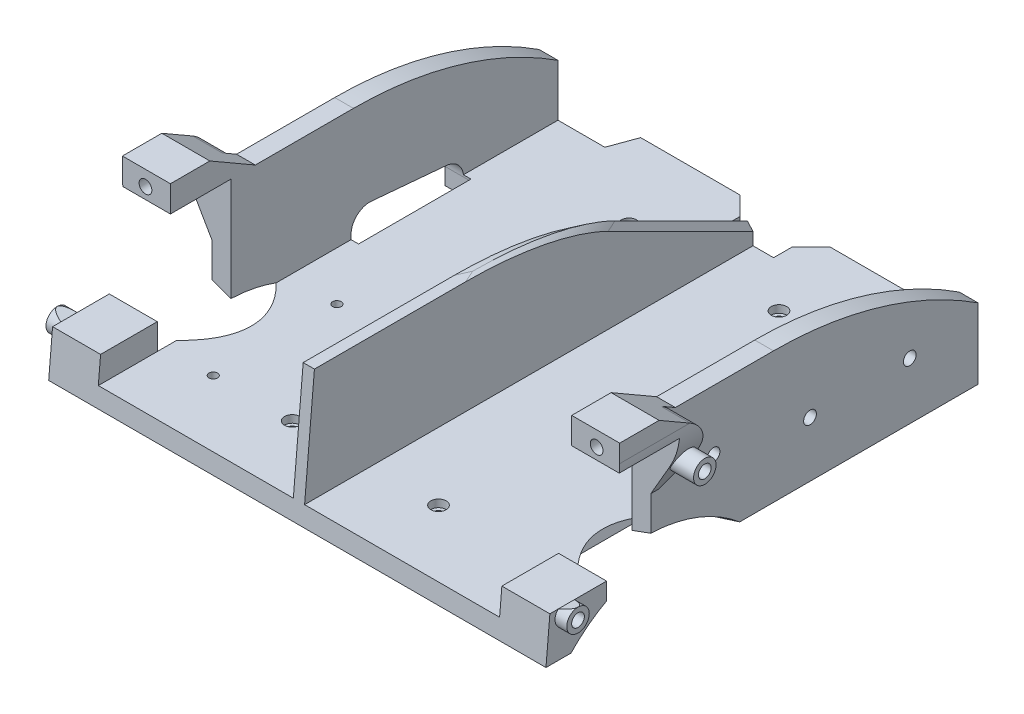
from build123d import *
from OCP.BRepFilletAPI import BRepFilletAPI_MakeChamfer

# Parameters (mm, degrees)
SKIZZE1_W                             = 113
SKIZZE1_H                             = 130
AUFSATZ_LINEAR_AUSTRAGEN1_DEPTH       = 5
SKIZZE2_W                             = 3
SKIZZE2_H                             = 130
AUFSATZ_LINEAR_AUSTRAGEN2_DEPTH       = 30
SKIZZE6_W                             = 113
SKIZZE6_H                             = 3.050450996
SCHNITT_LINEAR_AUSTRAGEN4_DEPTH       = 118.72988197
SCHNITT_LINEAR_AUSTRAGEN6_DEPTH       = 10
AUFSATZ_LINEAR_AUSTRAGEN3_REACH       = 133.888
AUFSATZ_LINEAR_START                  = 0.5
SKIZZE10_W                            = 12.8
SKIZZE10_H                            = 11.9
SKIZZE12_W                            = 12.8
SKIZZE12_H                            = 7
AUFSATZ_LINEAR_AUSTRAGEN4_DEPTH       = 26.1
SKIZZE13_W                            = 12.8
SKIZZE13_H                            = 10
AUFSATZ_LINEAR_AUSTRAGEN6_DEPTH       = 27
FASE1_SIZE                            = 16.9
FASE1_SIZE2                           = 9.757219549
FASE3_SIZE                            = 9
FASE3_SIZE2                           = 15.588457268
VERRUNDUNG7_R                         = 1.5
VERRUNDUNG8_R                         = 20
SKIZZE14_R                            = 1.7
SCHNITT_LINEAR_AUSTRAGEN8_DEPTH       = 4
SKIZZE15_R                            = 1.7
SCHNITT_LINEAR_AUSTRAGEN9_DEPTH       = 4
SCHNITT_LINEAR_AUSTRAGEN10_DEPTH      = 146.151093777
SKIZZE20_R                            = 3
AUFSATZ_LINEAR_AUSTRAGEN8_DEPTH       = 12.93
SKIZZE21_R                            = 1.7
SCHNITT_LINEAR_AUSTRAGEN12_DEPTH      = 4
SCHNITT_LINEAR_START                  = -58
SCHNITT_LINEAR_AUSTRAGEN15_DEPTH      = 3
FASE4_SIZE                            = 1.5
VERRUNDUNG9_R                         = 20
SKIZZE24_R                            = 1.15
SCHNITT_LINEAR_AUSTRAGEN16_DEPTH      = 103.051579674
SKIZZE25_R                            = 1.15
SCHNITT_LINEAR_AUSTRAGEN17_DEPTH      = 103.051579674
SKIZZE28_R                            = 3
AUFSATZ_LINEAR_AUSTRAGEN9_DEPTH       = 3.13
SKIZZE22_R                            = 1.7
SCHNITT_LINEAR_AUSTRAGEN14_DEPTH      = 4
AUFSATZ_LINEAR_START_2                = -138.86
SKIZZE32_R                            = 3
AUFSATZ_LINEAR_AUSTRAGEN10_DEPTH      = 12.93
AUFSATZ_LINEAR_START_3                = 3.13
SKIZZE33_R                            = 3
AUFSATZ_LINEAR_AUSTRAGEN11_DEPTH      = 3.13
SCHNITT_LINEAR_AUSTRAGEN22_DEPTH      = 153.364427967
SCHNITT_LINEAR_START_2                = -4
SKIZZE34_R                            = 1.7
SCHNITT_LINEAR_AUSTRAGEN23_DEPTH      = 4
SKIZZE35_R                            = 1.15
SCHNITT_LINEAR_AUSTRAGEN24_DEPTH      = 103.051579674
SCHNITT_LINEAR_AUSTRAGEN25_DEPTH      = 103.051579674
SCHNITT_LINEAR_AUSTRAGEN25_DEPTH_BACK = 103.051579674
SKIZZE36_W                            = 14
SKIZZE36_H                            = 10
AUFSATZ_LINEAR_AUSTRAGEN12_DEPTH      = 2
AUFSATZ_LINEAR_AUSTRAGEN13_DEPTH      = 2
SCHNITT_LINEAR_START_3                = -10
SKIZZE4_R                             = 40
SCHNITT_LINEAR_AUSTRAGEN2_DEPTH       = 148.118472914
SCHNITT_LINEAR_AUSTRAGEN18_DEPTH      = 148.808541449
SCHNITT_LINEAR_AUSTRAGEN18_DEPTH_BACK = 5
SCHNITT_LINEAR_AUSTRAGEN26_DEPTH      = 5
SCHNITT_LINEAR_START_4                = -112
SCHNITT_LINEAR_AUSTRAGEN27_DEPTH      = 38.516169445
SKIZZE42_W                            = 5
SKIZZE42_H                            = 7
SCHNITT_LINEAR_AUSTRAGEN28_DEPTH      = 103.051579674
FASE5_SIZE                            = 5
FASE6_SIZE                            = 7
FASE6_SIZE_2                          = 2.54779164
VERRUNDUNG10_R                        = 100
SCHNITT_LINEAR_AUSTRAGEN29_DEPTH      = 103.051579674
SCHNITT_LINEAR_AUSTRAGEN29_DEPTH_BACK = 103.051579674
SKIZZE43_W                            = 12.5
SKIZZE43_H                            = 7
SKIZZE44_R                            = 1.7
SCHNITT_LINEAR_AUSTRAGEN30_DEPTH      = 4
SKIZZE45_W                            = 5
SKIZZE45_H                            = 19.6
SCHNITT_LINEAR_AUSTRAGEN31_DEPTH      = 11.9
SKIZZE46_R                            = 2.05
SCHNITT_LINEAR_AUSTRAGEN32_DEPTH      = 2
VERRUNDUNG11_R                        = 5


# Some blends are built 0.0001 mm under size
with BuildPart() as part:
    # Skizze1 → Aufsatz-Linear austragen1 (new body)
    with BuildSketch(Plane(origin=(0, 0, 0), x_dir=(1, 0, 0), z_dir=(0, 1, 0))):
        Rectangle(SKIZZE1_W, SKIZZE1_H)
    extrude(amount=AUFSATZ_LINEAR_AUSTRAGEN1_DEPTH)

    # Skizze2 → Aufsatz-Linear austragen2 (add)
    with BuildSketch(Plane(origin=(0, 5, 0), x_dir=(1, 0, 0), z_dir=(0, 1, 0))):
        with Locations((-55, 0)):
            Rectangle(SKIZZE2_W, SKIZZE2_H)
        with Locations((55, 0)):
            Rectangle(SKIZZE2_W, SKIZZE2_H)
        Rectangle(SKIZZE2_W, SKIZZE2_H)
    extrude(amount=AUFSATZ_LINEAR_AUSTRAGEN2_DEPTH)

    # Skizze6 → Schnitt-Linear austragen4 (cut, through all)
    with BuildSketch(Plane(origin=(0, -42.137731894, 3.686573847), x_dir=(1, 0, 0), z_dir=(0, 0.9961946980917462, -0.08715574274765159))):
        with Locations((0, -66.277880874)):
            Rectangle(SKIZZE6_W, SKIZZE6_H)
    extrude(amount=SCHNITT_LINEAR_AUSTRAGEN4_DEPTH, mode=Mode.SUBTRACT)

    # Skizze8 → Schnitt-Linear austragen6 (cut)
    with BuildSketch(Plane(origin=(56.5, 0, 0), x_dir=(0, 0, -1), z_dir=(1, 0, 0))):
        Polygon((-29.237896777, 35), (-29.237896777, 11.9), (-45.337896777, 11.9), (-45.337896777, 6.9), (-48.837896777, 6.9), (-48.837896777, 11.9), (-63.958884904, 11.9), (-61.937896777, 35), align=None)
    schnitt_linear_austragen6 = extrude(amount=-SCHNITT_LINEAR_AUSTRAGEN6_DEPTH, mode=Mode.SUBTRACT)

    # Spiegeln2: Schnitt-Linear austragen6 across plane
    add(schnitt_linear_austragen6.mirror(Plane.ZY), mode=Mode.SUBTRACT)

    # Aufsatz-Linear austragen3: up to this plane
    aufsatz_linear_austragen3_end = Plane(origin=(-56.5, 46.021267226, 60.973660837), z_dir=(0, 0.08715574274765159, 0.9961946980917461))
    # Skizze10 → Aufsatz-Linear austragen3 (add, up to the surface)
    with BuildSketch(Plane.XY.offset(48.337896777).offset(AUFSATZ_LINEAR_START), mode=Mode.PRIVATE) as aufsatz_linear_austragen3_sk1:
        with Locations((-59.9, 5.95)):
            Rectangle(SKIZZE10_W, SKIZZE10_H)
    aufsatz_linear_austragen3_tool1 = split(extrude(aufsatz_linear_austragen3_sk1.sketch, amount=AUFSATZ_LINEAR_AUSTRAGEN3_REACH, mode=Mode.PRIVATE), bisect_by=aufsatz_linear_austragen3_end, keep=Keep.BOTH, mode=Mode.PRIVATE)
    add(aufsatz_linear_austragen3_tool1.solids().sort_by_distance((-59.9, 5.95, 48.837897))[0])
    # Skizze10 → Aufsatz-Linear austragen3 (add, up to the surface)
    with BuildSketch(Plane.XY.offset(48.337896777).offset(AUFSATZ_LINEAR_START), mode=Mode.PRIVATE) as aufsatz_linear_austragen3_sk2:
        with Locations((59.9, 5.95)):
            Rectangle(SKIZZE10_W, SKIZZE10_H)
    aufsatz_linear_austragen3_tool2 = split(extrude(aufsatz_linear_austragen3_sk2.sketch, amount=AUFSATZ_LINEAR_AUSTRAGEN3_REACH, mode=Mode.PRIVATE), bisect_by=aufsatz_linear_austragen3_end, keep=Keep.BOTH, mode=Mode.PRIVATE)
    add(aufsatz_linear_austragen3_tool2.solids().sort_by_distance((59.9, 5.95, 48.837897))[0])

    # Skizze12 → Aufsatz-Linear austragen4 (add)
    with BuildSketch(Plane(origin=(0, 0, 45.837896777), x_dir=(-1, 0, 0), z_dir=(0, 0, -1)).offset(AUFSATZ_LINEAR_START)):
        with Locations((59.9, 38.5)):
            Rectangle(SKIZZE12_W, SKIZZE12_H)
        with Locations((-59.9, 38.5)):
            Rectangle(SKIZZE12_W, SKIZZE12_H)
    extrude(amount=AUFSATZ_LINEAR_AUSTRAGEN4_DEPTH)

    # Skizze13 → Aufsatz-Linear austragen6 (add)
    with BuildSketch(Plane(origin=(0, 42, 0), x_dir=(1, 0, 0), z_dir=(0, 1, 0))):
        with Locations((-59.9, -24.237896777)):
            Rectangle(SKIZZE13_W, SKIZZE13_H)
        with Locations((59.9, -24.237896777)):
            Rectangle(SKIZZE13_W, SKIZZE13_H)
    extrude(amount=-AUFSATZ_LINEAR_AUSTRAGEN6_DEPTH)

    # Fase1: one chamfer whose edges measure the first distance from different faces: ONE call of the kernel's chamfer builder (chamfer() names one face for all edges)
    fase1_edges_1 = [part.edges().sort_by_distance(p)[0] for p in [
        (-61.4, 15, 19.237896777),
    ]]
    fase1_side_1 = [part.faces().sort_by_distance(p)[0] for p in [
        (-60.929411765, 29.235294118, 19.237896777),
    ]]
    fase1_edges_2 = [part.edges().sort_by_distance(p)[0] for p in [
        (-66.3, 15, 24.237896777),
    ]]
    fase1_side_2 = [part.faces().sort_by_distance(p)[0] for p in [
        (-66.3, 31.44486543, 28.080946163),
    ]]
    fase1_edges_3 = [part.edges().sort_by_distance(p)[0] for p in [
        (61.4, 15, 19.237896777),
    ]]
    fase1_side_3 = [part.faces().sort_by_distance(p)[0] for p in [
        (60.929411765, 29.235294118, 19.237896777),
    ]]
    fase1_edges_4 = [part.edges().sort_by_distance(p)[0] for p in [
        (66.3, 15, 24.237896777),
    ]]
    fase1_side_4 = [part.faces().sort_by_distance(p)[0] for p in [
        (66.3, 31.44486543, 28.080946163),
    ]]
    fase1 = BRepFilletAPI_MakeChamfer(part.part.solid().wrapped)
    for e in fase1_edges_1:
        fase1.Add(FASE1_SIZE, FASE1_SIZE2, e.wrapped, fase1_side_1[0].wrapped)  # the first distance lies on this face
    for e in fase1_edges_2:
        fase1.Add(FASE1_SIZE, FASE1_SIZE2, e.wrapped, fase1_side_2[0].wrapped)  # the first distance lies on this face
    for e in fase1_edges_3:
        fase1.Add(FASE1_SIZE, FASE1_SIZE2, e.wrapped, fase1_side_3[0].wrapped)  # the first distance lies on this face
    for e in fase1_edges_4:
        fase1.Add(FASE1_SIZE, FASE1_SIZE2, e.wrapped, fase1_side_4[0].wrapped)  # the first distance lies on this face
    add(Compound.cast(fase1.Shape()), mode=Mode.REPLACE)

    # Fase3: one chamfer whose edges measure the first distance from different faces: ONE call of the kernel's chamfer builder (chamfer() names one face for all edges)
    fase3_edges_1 = [part.edges().sort_by_distance(p)[0] for p in [
        (-59.9, 42, 19.237896777),
    ]]
    fase3_side_1 = [part.faces().sort_by_distance(p)[0] for p in [
        (-60.279813302, 37.221295216, 19.237896777),
    ]]
    fase3_edges_2 = [part.edges().sort_by_distance(p)[0] for p in [
        (59.9, 42, 19.237896777),
    ]]
    fase3_side_2 = [part.faces().sort_by_distance(p)[0] for p in [
        (60.279813302, 37.221295216, 19.237896777),
    ]]
    fase3 = BRepFilletAPI_MakeChamfer(part.part.solid().wrapped)
    for e in fase3_edges_1:
        fase3.Add(FASE3_SIZE, FASE3_SIZE2, e.wrapped, fase3_side_1[0].wrapped)  # the first distance lies on this face
    for e in fase3_edges_2:
        fase3.Add(FASE3_SIZE, FASE3_SIZE2, e.wrapped, fase3_side_2[0].wrapped)  # the first distance lies on this face
    add(Compound.cast(fase3.Shape()), mode=Mode.REPLACE)

    # Verrundung7
    verrundung7_edges = [part.edges().sort_by_distance(p)[0] for p in [
        (61.4, 33, 19.237896777),
        (-61.4, 33, 19.237896777),
    ]]
    fillet(verrundung7_edges, radius=VERRUNDUNG7_R)

    # Verrundung8
    # the kernel refuses this fillet: 20 mm, written as the material it takes off along each edge
    with BuildSketch(Plane(origin=(-66.3, 31.9, 61.391799868), x_dir=(0, 1, 0), z_dir=(0, 0, -1))) as verrundung8_piece_1:
        with BuildLine():
            CenterArc((VERRUNDUNG8_R * 0.267949192431, VERRUNDUNG8_R), VERRUNDUNG8_R, 240, 30)
            Line((-VERRUNDUNG8_R * 0.232050807569, VERRUNDUNG8_R * 0.133974596216), (-VERRUNDUNG8_R * 0.242050807569, VERRUNDUNG8_R * 0.11665408814))
            Line((-VERRUNDUNG8_R * 0.242050807569, VERRUNDUNG8_R * 0.11665408814), (-VERRUNDUNG8_R * 0.00535898384862, -VERRUNDUNG8_R * 0.02))
            Line((-VERRUNDUNG8_R * 0.00535898384862, -VERRUNDUNG8_R * 0.02), (VERRUNDUNG8_R * 0.267949192431, -VERRUNDUNG8_R * 0.02))
            Line((VERRUNDUNG8_R * 0.267949192431, -VERRUNDUNG8_R * 0.02), (VERRUNDUNG8_R * 0.267949192431, 0))
        make_face()
    extrude(amount=74.307806183, mode=Mode.SUBTRACT)
    with BuildSketch(Plane(origin=(66.3, 31.9, 61.391799868), x_dir=(0, 1, 0), z_dir=(0, 0, -1))) as verrundung8_piece_2:
        with BuildLine():
            CenterArc((VERRUNDUNG8_R * 0.267949192431, -VERRUNDUNG8_R), VERRUNDUNG8_R, 90, 30)
            Line((-VERRUNDUNG8_R * 0.232050807569, -VERRUNDUNG8_R * 0.133974596216), (-VERRUNDUNG8_R * 0.242050807569, -VERRUNDUNG8_R * 0.11665408814))
            Line((-VERRUNDUNG8_R * 0.242050807569, -VERRUNDUNG8_R * 0.11665408814), (-VERRUNDUNG8_R * 0.00535898384862, VERRUNDUNG8_R * 0.02))
            Line((-VERRUNDUNG8_R * 0.00535898384862, VERRUNDUNG8_R * 0.02), (VERRUNDUNG8_R * 0.267949192431, VERRUNDUNG8_R * 0.02))
            Line((VERRUNDUNG8_R * 0.267949192431, VERRUNDUNG8_R * 0.02), (VERRUNDUNG8_R * 0.267949192431, 0))
        make_face()
    extrude(amount=74.307806183, mode=Mode.SUBTRACT)

    # Skizze14 → Schnitt-Linear austragen8 (cut)
    with BuildSketch(Plane(origin=(0, 0, 48.837896777), x_dir=(-1, 0, 0), z_dir=(0, 0, -1))):
        with Locations((60.15, 9.4)):
            Circle(SKIZZE14_R)
        with Locations(Location((-60.15, 9.4, 0), (0, 0, 180))):
            Circle(SKIZZE14_R)
    extrude(amount=-SCHNITT_LINEAR_AUSTRAGEN8_DEPTH, mode=Mode.SUBTRACT)

    # Skizze15 → Schnitt-Linear austragen9 (cut)
    with BuildSketch(Plane.XY.offset(45.337896777)):
        with Locations((60.15, 38)):
            Circle(SKIZZE15_R)
        with Locations(Location((-60.15, 38, 0), (0, 0, 180))):
            Circle(SKIZZE15_R)
    extrude(amount=-SCHNITT_LINEAR_AUSTRAGEN9_DEPTH, mode=Mode.SUBTRACT)

    # Skizze16 → Schnitt-Linear austragen10 (cut, through all)
    with BuildSketch(Plane.ZY.offset(56.5)):
        with BuildLine():
            Line((23.261582805, 24.930771366), (18.761582805, 32.725))
            Line((18.761582805, 32.725), (26.555811439, 37.225))
            ThreePointArc((26.555811439, 37.225), (22.362479002, 31.760142772), (23.261582805, 24.930771366))
        make_face()
    schnitt_linear_austragen10 = extrude(amount=SCHNITT_LINEAR_AUSTRAGEN10_DEPTH, mode=Mode.SUBTRACT)

    # Spiegeln4: Schnitt-Linear austragen10 across plane
    add(schnitt_linear_austragen10.mirror(Plane.ZY), mode=Mode.SUBTRACT)

    # Skizze20 → Aufsatz-Linear austragen8 (add)
    with BuildSketch(Plane.ZY.offset(56.5)):
        with Locations((25.779837421, 27.258983849)):
            Circle(SKIZZE20_R)
    extrude(amount=AUFSATZ_LINEAR_AUSTRAGEN8_DEPTH)

    # Skizze21 → Schnitt-Linear austragen12 (cut)
    with BuildSketch(Plane.ZY.offset(69.43)):
        with Locations((25.779837421, 27.258983849)):
            Circle(SKIZZE21_R)
    extrude(amount=-SCHNITT_LINEAR_AUSTRAGEN12_DEPTH, mode=Mode.SUBTRACT)

    # Skizze23 → Schnitt-Linear austragen15 (cut)
    with BuildSketch(Plane.ZY.offset(56.5).offset(SCHNITT_LINEAR_START)):
        Polygon((-65, 5), (-5, 35), (-65, 35), align=None)
    extrude(amount=SCHNITT_LINEAR_AUSTRAGEN15_DEPTH, mode=Mode.SUBTRACT)

    # Fase4
    fase4_edges = [part.edges().sort_by_distance(p)[0] for p in [
        (1.5, 20, -35),
        (-1.5, 20, -35),
    ]]
    chamfer(fase4_edges, length=FASE4_SIZE - 0.0001)  # a hair under: the kernel refuses the full size

    # Verrundung9
    # the kernel refuses this fillet: 20 mm, written as the material it takes off along each edge
    with BuildSketch(Plane(origin=(9.685547168, 35, -26.657765474), x_dir=(-0.5773502691896261, -0.774596669241483, -0.2581988897471616), z_dir=(-0.4082482904638634, 0, 0.9128709291752767)), Plane(origin=(-9.685547168, 35, -26.657765474), x_dir=(-0.9128709291752767, 0, 0.4082482904638635), z_dir=(0.4082482904638635, 0, 0.9128709291752767))) as verrundung9_piece_1:
        with BuildLine():
            CenterArc((VERRUNDUNG9_R * 0.474497867808, VERRUNDUNG9_R), VERRUNDUNG9_R, 219.231520484, 50.768479516)
            Line((-VERRUNDUNG9_R * 0.300098801433, VERRUNDUNG9_R * 0.367544467966), (0, 0))
            Line((0, 0), (VERRUNDUNG9_R * 0.474497867808, 0))
        make_face()
    extrude(amount=51.123776446, mode=Mode.SUBTRACT)

    # Skizze24 → Schnitt-Linear austragen16 (cut, through all)
    with BuildSketch(Plane(origin=(0, 5, 0), x_dir=(1, 0, 0), z_dir=(0, 1, 0))):
        with Locations(Location((-40.5, -13.943887949, 0), (0, 0, 270))):
            Circle(SKIZZE24_R)
        with Locations(Location((-40.5, -46.908717461, 0), (0, 0, 90))):
            Circle(SKIZZE24_R)
    extrude(amount=-SCHNITT_LINEAR_AUSTRAGEN16_DEPTH, mode=Mode.SUBTRACT)

    # Skizze25 → Schnitt-Linear austragen17 (cut, through all)
    with BuildSketch(Plane(origin=(0, 5, 0), x_dir=(1, 0, 0), z_dir=(0, 1, 0))):
        with Locations(Location((19.5, -46.85531681, 0), (0, 0, 270))):
            Circle(SKIZZE25_R)
        with Locations(Location((-19.5, -46.85531681, 0), (0, 0, 90))):
            Circle(SKIZZE25_R)
        with Locations(Location((-19.5, -3.691063796, 0), (0, 0, 270))):
            Circle(SKIZZE25_R)
        with Locations(Location((19.5, -3.691063796, 0), (0, 0, 90))):
            Circle(SKIZZE25_R)
    extrude(amount=-SCHNITT_LINEAR_AUSTRAGEN17_DEPTH, mode=Mode.SUBTRACT)

    # Skizze28 → Aufsatz-Linear austragen9 (add)
    with BuildSketch(Plane.ZY.offset(66.3)):
        with Locations(Location((59.583136661, 9.824373146, 0), (0, 0, 136.221235719))):
            Circle(SKIZZE28_R)
    extrude(amount=AUFSATZ_LINEAR_AUSTRAGEN9_DEPTH)

    # Skizze22 → Schnitt-Linear austragen14 (cut)
    with BuildSketch(Plane.ZY.offset(69.43)):
        with Locations((59.583136661, 9.824373146)):
            Circle(SKIZZE22_R)
    extrude(amount=-SCHNITT_LINEAR_AUSTRAGEN14_DEPTH, mode=Mode.SUBTRACT)

    # Skizze32 → Aufsatz-Linear austragen10 (add)
    with BuildSketch(Plane.ZY.offset(69.43).offset(AUFSATZ_LINEAR_START_2)):
        with Locations((25.779837421, 27.258983849)):
            Circle(SKIZZE32_R)
    extrude(amount=AUFSATZ_LINEAR_AUSTRAGEN10_DEPTH)

    # Skizze33 → Aufsatz-Linear austragen11 (add)
    with BuildSketch(Plane(origin=(66.3, 0, 0), x_dir=(0, 0, -1), z_dir=(1, 0, 0)).offset(AUFSATZ_LINEAR_START_3)):
        with Locations(Location((-59.583136661, 9.824373146, 0), (0, 0, 43.778764281))):
            Circle(SKIZZE33_R)
    extrude(amount=-AUFSATZ_LINEAR_AUSTRAGEN11_DEPTH)

    # Skizze31 → Schnitt-Linear austragen22 (cut, through all)
    with BuildSketch(Plane(origin=(0, 0, 63.958884904), x_dir=(-1, 0, 0), z_dir=(0, 0, -1))):
        Polygon((66.3, 11.9), (69.43, 12.824373146), (66.3, 12.824373146), align=None)
        Polygon((-69.43, 12.824373146), (-66.3, 12.824373146), (-66.3, 11.9), align=None)
    extrude(amount=SCHNITT_LINEAR_AUSTRAGEN22_DEPTH, mode=Mode.SUBTRACT)

    # Skizze34 → Schnitt-Linear austragen23 (cut)
    with BuildSketch(Plane(origin=(69.43, 0, 0), x_dir=(0, 0, -1), z_dir=(1, 0, 0)).offset(SCHNITT_LINEAR_START_2)):
        with Locations(Location((-25.779837421, 27.258983849, 0), (0, 0, 180))):
            Circle(SKIZZE34_R)
        with Locations(Location((-59.583136661, 9.824373146, 0), (0, 0, 180))):
            Circle(SKIZZE34_R)
    extrude(amount=SCHNITT_LINEAR_AUSTRAGEN23_DEPTH, mode=Mode.SUBTRACT)

    # Skizze35 → Schnitt-Linear austragen24 (cut, through all)
    with BuildSketch(Plane(origin=(0, 5, 0), x_dir=(1, 0, 0), z_dir=(0, 1, 0))):
        with Locations(Location((20, 43.425098055, 0), (0, 0, 270))):
            Circle(SKIZZE35_R)
        with Locations(Location((-20, 43.425098055, 0), (0, 0, 90))):
            Circle(SKIZZE35_R)
    extrude(amount=-SCHNITT_LINEAR_AUSTRAGEN24_DEPTH, mode=Mode.SUBTRACT)

    # Skizze36 → Schnitt-Linear austragen25 (cut, two sides: drawn at the far end of the back side and taken through both)
    with BuildSketch(Plane(origin=(0, 5, 0), x_dir=(1, 0, 0), z_dir=(0, 1, 0)).offset(-SCHNITT_LINEAR_AUSTRAGEN25_DEPTH_BACK)):
        with Locations((0, 60)):
            Rectangle(SKIZZE36_W, SKIZZE36_H)
    extrude(amount=SCHNITT_LINEAR_AUSTRAGEN25_DEPTH + SCHNITT_LINEAR_AUSTRAGEN25_DEPTH_BACK, mode=Mode.SUBTRACT)

    # Skizze37 → Aufsatz-Linear austragen12 (add)
    with BuildSketch(Plane.ZY.offset(56.5)):
        with BuildLine():
            Line((-65, 35), (-65, 0))
            Line((-65, 0), (45.70531681, 0))
            Line((45.70531681, 0), (45.337896777, 11.9))
            Line((45.337896777, 11.9), (29.237896777, 11.9))
            Line((29.237896777, 11.9), (29.237896777, 24.258983849))
            Line((29.237896777, 24.258983849), (23.690174068, 24.258983849))
            Line((23.690174068, 24.258983849), (22.867414189, 25.695781342))
            Line((22.867414189, 25.695781342), (22.321778064, 27.258983849))
            ThreePointArc((22.321778064, 27.258983849), (22.772377409, 32.949964552), (26.555811439, 37.225))
            Line((26.555811439, 37.225), (22.701998392, 35))
            Line((22.701998392, 35), (-65, 35))
        make_face()
    extrude(amount=AUFSATZ_LINEAR_AUSTRAGEN12_DEPTH)

    # Skizze38 → Aufsatz-Linear austragen13 (add)
    with BuildSketch(Plane(origin=(56.5, 0, 0), x_dir=(0, 0, -1), z_dir=(1, 0, 0))):
        with BuildLine():
            Line((65, 35), (65, 0))
            Line((65, 0), (-45.337896777, 0))
            Line((-45.337896777, 0), (-45.337896777, 11.9))
            Line((-45.337896777, 11.9), (-29.237896777, 11.9))
            Line((-29.237896777, 11.9), (-29.237896777, 24.258983849))
            Line((-29.237896777, 24.258983849), (-23.649439508, 24.258983849))
            Line((-23.649439508, 24.258983849), (-22.863284339, 25.704848698))
            Line((-22.863284339, 25.704848698), (-22.321778064, 27.258983849))
            ThreePointArc((-22.321778064, 27.258983849), (-22.772377409, 32.949964552), (-26.555811439, 37.225))
            Line((-26.555811439, 37.225), (-22.701998392, 35))
            Line((-22.701998392, 35), (65, 35))
        make_face()
    extrude(amount=AUFSATZ_LINEAR_AUSTRAGEN13_DEPTH)

    # Skizze4 → Schnitt-Linear austragen2 (cut)
    with BuildSketch(Plane(origin=(-48.848657878, 17.779457451, 0), x_dir=(0, 0, -1), z_dir=(-0.9396926207859081, 0.34202014332566943, 0)).offset(SCHNITT_LINEAR_START_3)):
        with Locations((-30.426302705, 51.324138098)):
            Circle(SKIZZE4_R)
    schnitt_linear_austragen2 = extrude(amount=SCHNITT_LINEAR_AUSTRAGEN2_DEPTH, mode=Mode.SUBTRACT)

    # Spiegeln1: Schnitt-Linear austragen2 across plane
    add(schnitt_linear_austragen2.mirror(Plane.ZY), mode=Mode.SUBTRACT)

    # Skizze27 → Schnitt-Linear austragen18 (cut, two sides: drawn at the far end of the back side and taken through both)
    with BuildSketch(Plane.ZY.offset(56.5).offset(-SCHNITT_LINEAR_AUSTRAGEN18_DEPTH_BACK)):
        Polygon((-32.829441403, 9.02009448), (-2.829441403, 11.644754386), (-2.829441403, 0), (-32.829441403, 0), align=None)
    extrude(amount=SCHNITT_LINEAR_AUSTRAGEN18_DEPTH + SCHNITT_LINEAR_AUSTRAGEN18_DEPTH_BACK, mode=Mode.SUBTRACT)

    # Skizze40 → Schnitt-Linear austragen26 (cut)
    with BuildSketch(Plane.ZY.offset(58.5)):
        Polygon((-65, 13.993773854), (-35, 35), (-65, 35), align=None)
    extrude(amount=-SCHNITT_LINEAR_AUSTRAGEN26_DEPTH, mode=Mode.SUBTRACT)

    # Skizze41 → Schnitt-Linear austragen27 (cut, through all)
    with BuildSketch(Plane.ZY.offset(58.5).offset(SCHNITT_LINEAR_START_4)):
        Polygon((-65, 13.993773854), (-65, 35), (-35, 35), align=None)
    extrude(amount=-SCHNITT_LINEAR_AUSTRAGEN27_DEPTH, mode=Mode.SUBTRACT)

    # Skizze42 → Schnitt-Linear austragen28 (cut, through all)
    with BuildSketch(Plane(origin=(0, 5, 0), x_dir=(1, 0, 0), z_dir=(0, 1, 0))):
        with Locations((-43.5, 61.5)):
            Rectangle(SKIZZE42_W, SKIZZE42_H)
        with Locations((43.5, 61.5)):
            Rectangle(SKIZZE42_W, SKIZZE42_H)
    extrude(amount=-SCHNITT_LINEAR_AUSTRAGEN28_DEPTH, mode=Mode.SUBTRACT)

    # Fase5
    fase5_edges = [part.edges().sort_by_distance(p)[0] for p in [
        (7, 2.5, -65),
        (-7, 2.5, -65),
    ]]
    chamfer(fase5_edges, length=FASE5_SIZE)

    # Fase6
    fase6_edges_1 = [part.edges().sort_by_distance(p)[0] for p in [
        (-46, 2.5, -65),
    ]]
    fase6_side_1 = [part.faces().sort_by_distance(p)[0] for p in [
        (-46, 2.5, -64.949044167),
    ]]
    fase6_edges_2 = [part.edges().sort_by_distance(p)[0] for p in [
        (-41, 2.5, -65),
    ]]
    fase6_side_2 = [part.faces().sort_by_distance(p)[0] for p in [
        (-40.949044167, 2.5, -65),
    ]]
    fase6_edges_3 = [part.edges().sort_by_distance(p)[0] for p in [
        (41, 2.5, -65),
    ]]
    fase6_side_3 = [part.faces().sort_by_distance(p)[0] for p in [
        (40.949044167, 2.5, -65),
    ]]
    fase6_edges_4 = [part.edges().sort_by_distance(p)[0] for p in [
        (46, 2.5, -65),
    ]]
    fase6_side_4 = [part.faces().sort_by_distance(p)[0] for p in [
        (46, 2.5, -64.949044167),
    ]]
    fase6 = BRepFilletAPI_MakeChamfer(part.part.solid().wrapped)
    for e in fase6_edges_1:
        fase6.Add(FASE6_SIZE - 0.0001, FASE6_SIZE_2 - 0.0001, e.wrapped, fase6_side_1[0].wrapped)
    for e in fase6_edges_2:
        fase6.Add(FASE6_SIZE_2 - 0.0001, FASE6_SIZE - 0.0001, e.wrapped, fase6_side_2[0].wrapped)
    for e in fase6_edges_3:
        fase6.Add(FASE6_SIZE_2 - 0.0001, FASE6_SIZE - 0.0001, e.wrapped, fase6_side_3[0].wrapped)
    for e in fase6_edges_4:
        fase6.Add(FASE6_SIZE - 0.0001, FASE6_SIZE_2 - 0.0001, e.wrapped, fase6_side_4[0].wrapped)
    add(Compound.cast(fase6.Shape()), mode=Mode.REPLACE)  # a hair under: the kernel refuses the full size

    # Verrundung10
    verrundung10_edges = [part.edges().sort_by_distance(p)[0] for p in [
        (-56, 35, -35),
        (56, 35, -35),
    ]]
    fillet(verrundung10_edges, radius=VERRUNDUNG10_R)

    # Skizze43 → Schnitt-Linear austragen29 (cut, two sides: drawn at the far end of the back side and taken through both)
    with BuildSketch(Plane(origin=(0, 5, 0), x_dir=(1, 0, 0), z_dir=(0, 1, 0)).offset(-SCHNITT_LINEAR_AUSTRAGEN29_DEPTH_BACK)):
        with Locations((52.25, 61.5)):
            Rectangle(SKIZZE43_W, SKIZZE43_H)
        with Locations((-52.25, 61.5)):
            Rectangle(SKIZZE43_W, SKIZZE43_H)
    extrude(amount=SCHNITT_LINEAR_AUSTRAGEN29_DEPTH + SCHNITT_LINEAR_AUSTRAGEN29_DEPTH_BACK, mode=Mode.SUBTRACT)

    # Skizze44 → Schnitt-Linear austragen30 (cut)
    with BuildSketch(Plane(origin=(58.5, 0, 0), x_dir=(0, 0, -1), z_dir=(1, 0, 0))):
        with Locations((-12.521530051, 18.969329152)):
            Circle(SKIZZE44_R)
        with Locations(Location((13.212061367, 14.751672192, 0), (0, 0, 180))):
            Circle(SKIZZE44_R)
        with Locations((39.809827396, 15.116890366)):
            Circle(SKIZZE44_R)
    schnitt_linear_austragen30 = extrude(amount=-SCHNITT_LINEAR_AUSTRAGEN30_DEPTH, mode=Mode.SUBTRACT)

    # Spiegeln5: Schnitt-Linear austragen30 across plane
    add(schnitt_linear_austragen30.mirror(Plane.ZY), mode=Mode.SUBTRACT)

    # Skizze45 → Schnitt-Linear austragen31 (cut)
    with BuildSketch(Plane(origin=(0, 0, 0), x_dir=(-1, 0, 0), z_dir=(0, -1, 0))):
        with Locations((-56, -39.037896777)):
            Rectangle(SKIZZE45_W, SKIZZE45_H)
        with Locations((56, -39.037896777)):
            Rectangle(SKIZZE45_W, SKIZZE45_H)
    extrude(amount=-SCHNITT_LINEAR_AUSTRAGEN31_DEPTH, mode=Mode.SUBTRACT)

    # Skizze46 → Schnitt-Linear austragen32 (cut)
    with BuildSketch(Plane(origin=(0, 5, 0), x_dir=(1, 0, 0), z_dir=(0, 1, 0))):
        with Locations(Location((20, 43.425098055, 0), (0, 0, 270))):
            Circle(SKIZZE46_R)
        with Locations(Location((-20, 43.425098055, 0), (0, 0, 90))):
            Circle(SKIZZE46_R)
        with Locations(Location((-19.5, -3.691063796, 0), (0, 0, 270))):
            Circle(SKIZZE46_R)
        with Locations(Location((19.5, -3.691063796, 0), (0, 0, 90))):
            Circle(SKIZZE46_R)
        with Locations(Location((-19.5, -46.85531681, 0), (0, 0, 90))):
            Circle(SKIZZE46_R)
        with Locations(Location((19.5, -46.85531681, 0), (0, 0, 270))):
            Circle(SKIZZE46_R)
    extrude(amount=-SCHNITT_LINEAR_AUSTRAGEN32_DEPTH, mode=Mode.SUBTRACT)

    # Verrundung11
    verrundung11_edges = [part.edges().sort_by_distance(p)[0] for p in [
        (-56, 11.644754386, -2.829441403),
        (-56, 9.02009448, -32.829441403),
    ]]
    fillet(verrundung11_edges, radius=VERRUNDUNG11_R)


solid = part.part
